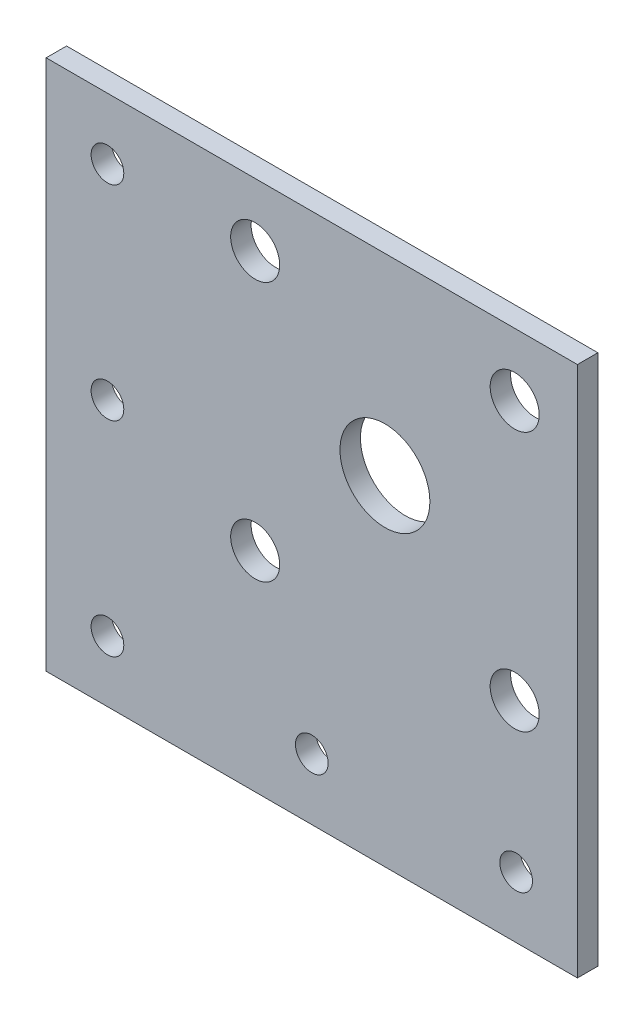
from build123d import *

# Parameters (mm, degrees)
SKETCH_1_W      = 130
SKETCH_1_H      = 130
SKETCH_1_R      = 4
SKETCH_1_R_2    = 6
SKETCH_1_R_3    = 11
EXTRUDE_1_DEPTH = 5


with BuildPart() as part:
    # 草图1 → 凸台-拉伸1 (new body)
    with BuildSketch(Plane.XY):
        with Locations((-17.9, -17.9)):
            Rectangle(SKETCH_1_W, SKETCH_1_H)
        with Locations((-67.9, -67.9)):
            Circle(SKETCH_1_R, mode=Mode.SUBTRACT)
        with Locations((-31.75, -31.75)):
            Circle(SKETCH_1_R_2, mode=Mode.SUBTRACT)
        with Locations((-17.9, -67.9)):
            Circle(SKETCH_1_R, mode=Mode.SUBTRACT)
        with Locations((32.1, -67.9)):
            Circle(SKETCH_1_R, mode=Mode.SUBTRACT)
        with Locations((31.75, -31.75)):
            Circle(SKETCH_1_R_2, mode=Mode.SUBTRACT)
        with Locations((-67.9, -17.9)):
            Circle(SKETCH_1_R, mode=Mode.SUBTRACT)
        with Locations((-67.9, 32.1)):
            Circle(SKETCH_1_R, mode=Mode.SUBTRACT)
        with Locations((-31.75, 31.75)):
            Circle(SKETCH_1_R_2, mode=Mode.SUBTRACT)
        Circle(SKETCH_1_R_3, mode=Mode.SUBTRACT)
        with Locations((31.75, 31.75)):
            Circle(SKETCH_1_R_2, mode=Mode.SUBTRACT)
    extrude(amount=EXTRUDE_1_DEPTH)


solid = part.part
